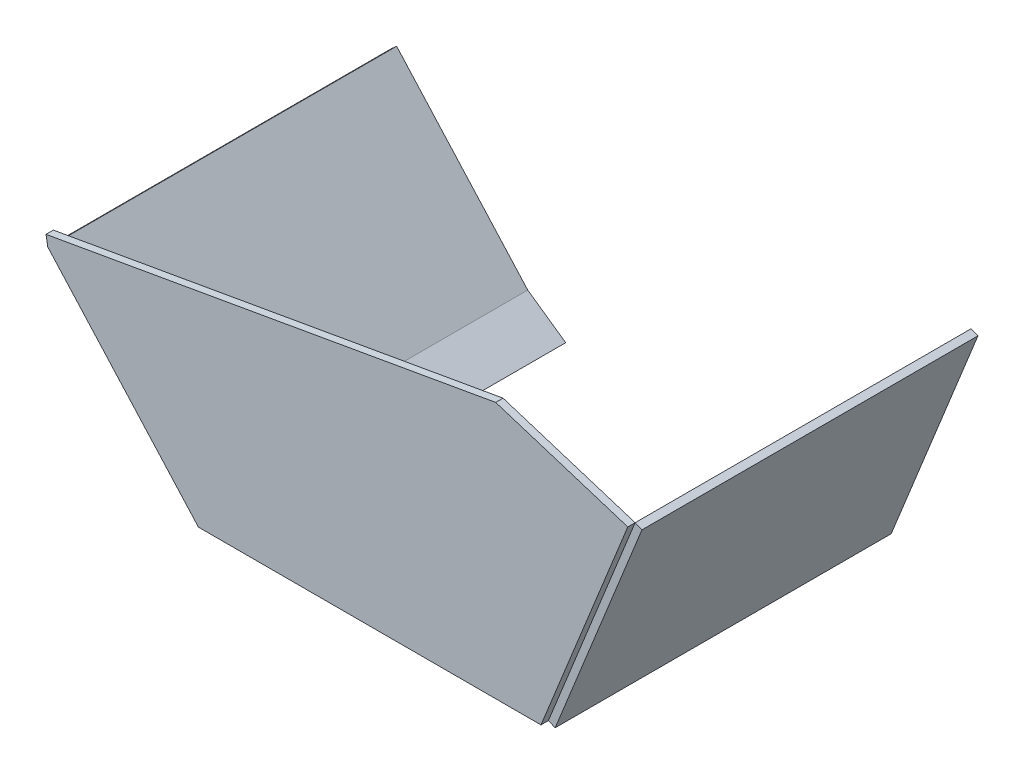
from build123d import *

# Parameters (mm, degrees)
BOSS_EXTRUDE1_DEPTH   = 290
BOSS_EXTRUDE1_2_DEPTH = 290
BOSS_EXTRUDE2_DEPTH   = 6.35


with BuildPart() as part:
    # Sketch1 → Boss-Extrude1 (new body)
    with BuildSketch(Plane.XY):
        Polygon((-164.212051746, 22.943057454), (-277.380151297, 148.628965095), (-282.099120939, 144.379985745), (-152.098797859, 0), (-131.445969974, 0), align=None)
    extrude(amount=BOSS_EXTRUDE1_DEPTH)


with BuildPart() as body_2:
    # Sketch1 → Boss-Extrude1 2 (new body)
    with BuildSketch(Plane.XY):
        Polygon((143.554030026, 0), (149.441647502, -2.378751868), (224.362966185, 183.058019045), (218.475348709, 185.436770913), align=None)
    extrude(amount=BOSS_EXTRUDE1_2_DEPTH)


with BuildPart() as body_3:
    # Sketch2 → Boss-Extrude2 (new body)
    with BuildSketch(Plane.XY.offset(290)):
        Polygon((-152.098797859, 0), (-282.099120939, 144.379985745), (-283.631995432, 153.07334899), (104.495710829, 221.510735565), (218.475348709, 185.436770913), (143.554030026, 0), align=None)
    extrude(amount=BOSS_EXTRUDE2_DEPTH)


solid = Compound([part.part, body_2.part, body_3.part])
